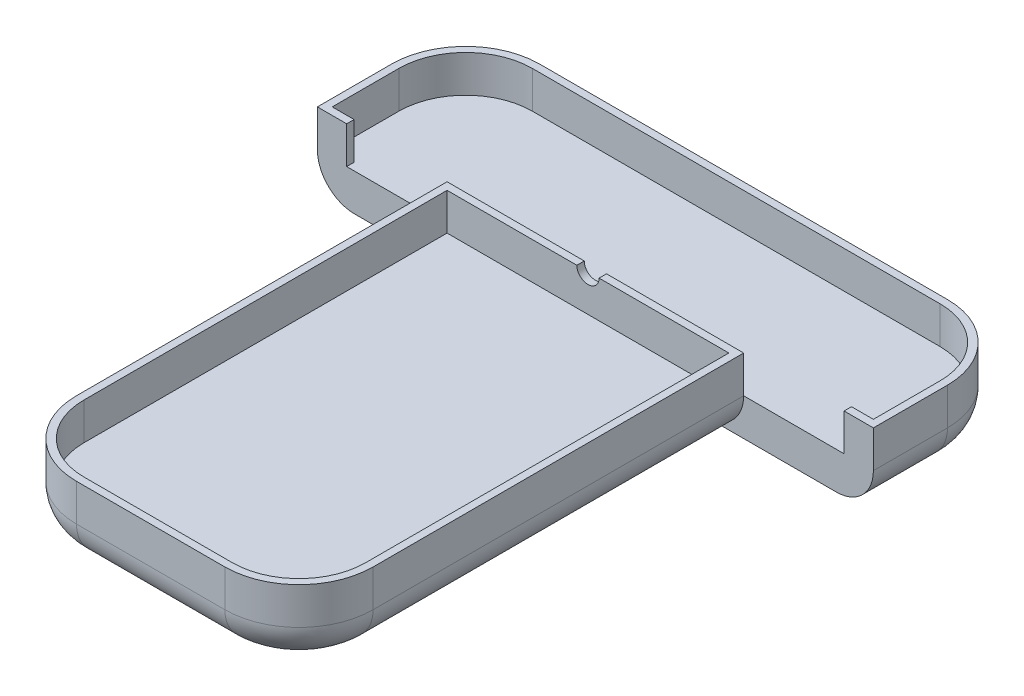
from build123d import *

# Parameters (mm, degrees)
BOSS_EXTRUDE1_DEPTH  = 25.4
FILLET1_R            = 12.7
FILLET3_R            = 25.4
FILLET4_R            = 25.4
FILLET5_R            = 25.4
SHELL1_T             = -2.54
EXTRUDE_THIN1_REACH  = 252.592
SKETCH2_W            = 2.54
SKETCH2_H            = 198.12
EXTRUDE_THIN4_REACH  = 252.592
SKETCH3_W            = 47.014483258
SKETCH3_H            = 2.54
SKETCH3_W_2          = 47.014483257
EXTRUDE_THIN5_REACH  = 252.592
SKETCH5_W            = 47.014483258
SKETCH5_H            = 2.54
SKETCH5_W_2          = 47.014483257
EXTRUDE_THIN10_START = 10.16
EXTRUDE_THIN10_DEPTH = 2.54
EXTRUDE_THIN11_START = 10.16
EXTRUDE_THIN11_DEPTH = 2.54
CUT_EXTRUDE2_REACH   = 214.64
SKETCH11_W           = 34.417
SKETCH11_H           = 12.7
CUT_EXTRUDE3_REACH   = 253.556
SKETCH12_W           = 2.54
SKETCH12_H           = 12.7
CUT_EXTRUDE4_REACH   = 253.556
SKETCH13_W           = 2.54
SKETCH13_H           = 12.7
SKETCH14_W           = 96.568966515
SKETCH14_H           = 2.54
EXTRUDE_THIN13_DEPTH = 12.7
CUT_EXTRUDE6_REACH   = 212.827


with BuildPart() as part:
    # Sketch1 → Boss-Extrude1 (new body)
    with BuildSketch(Plane(origin=(0, 0, 0), x_dir=(1, 0, 0), z_dir=(0, 1, 0))):
        Polygon((0, 0), (0, 152.4), (-44.45, 152.4), (-44.45, 203.2), (146.098966515, 203.2), (146.098966515, 152.4), (101.648966515, 152.4), (101.648966515, 0), align=None)
    extrude(amount=BOSS_EXTRUDE1_DEPTH)

    # Fillet1
    fillet1_edges = [part.edges().sort_by_distance(p)[0] for p in [
        (146.098966515, 0, -177.8),
        (101.648966515, 0, -76.2),
        (50.824483258, 0, 0),
        (0, 0, -76.2),
        (-44.45, 0, -177.8),
        (50.824483258, 0, -203.2),
    ]]
    fillet(fillet1_edges, radius=FILLET1_R)

    # Fillet3
    # the kernel refuses this fillet: 25.4 mm, written as the material it takes off along each edge
    with BuildSketch(Plane(origin=(76.248966515, 0, -25.4), x_dir=(1, 0, 0), z_dir=(0, 0, -1))) as fillet3_piece_1:
        with BuildLine():
            CenterArc((12.7, -12.7), 12.7, 0, 90)
            Line((25.4, -12.7), (25.4, 0))
            Line((25.4, 0), (12.7, 0))
        make_face()
    revolve(axis=Axis((76.248966515, 0, -25.4), (0, -1, 0)), revolution_arc=90, mode=Mode.SUBTRACT)
    with BuildSketch(Plane(origin=(101.648966515, 0, 0), x_dir=(0, 0, -1), z_dir=(0, 1, 0))) as fillet3_piece_2:
        with BuildLine():
            CenterArc((FILLET3_R, FILLET3_R), FILLET3_R, 180, 90)
            Line((0, FILLET3_R), (0, 0))
            Line((0, 0), (FILLET3_R, 0))
        make_face()
    extrude(amount=88.9, mode=Mode.SUBTRACT)

    # Fillet4
    # the kernel refuses this fillet: 25.4 mm, written as the material it takes off along each edge
    with BuildSketch(Plane(origin=(25.4, 0, -25.4), x_dir=(0, 0, 1), z_dir=(1, 0, 0))) as fillet4_piece_1:
        with BuildLine():
            CenterArc((12.7, -12.7), 12.7, 0, 90)
            Line((25.4, -12.7), (25.4, 0))
            Line((25.4, 0), (12.7, 0))
        make_face()
    revolve(axis=Axis((25.4, 0, -25.4), (0, -1, 0)), revolution_arc=90, mode=Mode.SUBTRACT)
    with BuildSketch(Plane(origin=(0, 0, 0), x_dir=(0, 0, -1), z_dir=(0, 1, 0))) as fillet4_piece_2:
        with BuildLine():
            CenterArc((FILLET4_R, -FILLET4_R), FILLET4_R, 90, 90)
            Line((0, -FILLET4_R), (0, 0))
            Line((0, 0), (FILLET4_R, 0))
        make_face()
    extrude(amount=88.9, mode=Mode.SUBTRACT)

    # Fillet5
    # the kernel refuses this fillet: 25.4 mm, written as the material it takes off along each edge
    with BuildSketch(Plane(origin=(120.698966515, 0, -177.8), x_dir=(0, 0, -1), z_dir=(-1, 0, 0))) as fillet5_piece_1:
        with BuildLine():
            CenterArc((12.7, -12.7), 12.7, 0, 90)
            Line((25.4, -12.7), (25.4, 0))
            Line((25.4, 0), (12.7, 0))
        make_face()
    revolve(axis=Axis((120.698966515, 0, -177.8), (0, -1, 0)), revolution_arc=90, mode=Mode.SUBTRACT)
    with BuildSketch(Plane(origin=(-19.05, 0, -177.8), x_dir=(-1, 0, 0), z_dir=(0, 0, 1))) as fillet5_piece_2:
        with BuildLine():
            CenterArc((12.7, -12.7), 12.7, 0, 90)
            Line((25.4, -12.7), (25.4, 0))
            Line((25.4, 0), (12.7, 0))
        make_face()
    revolve(axis=Axis((-19.05, 0, -177.8), (0, -1, 0)), revolution_arc=90, mode=Mode.SUBTRACT)
    with BuildSketch(Plane(origin=(-44.45, 0, -203.2), x_dir=(0, 0, 1), z_dir=(0, 1, 0))) as fillet5_piece_3:
        with BuildLine():
            CenterArc((FILLET5_R, FILLET5_R), FILLET5_R, 180, 90)
            Line((0, FILLET5_R), (0, 0))
            Line((0, 0), (FILLET5_R, 0))
        make_face()
    extrude(amount=88.9, mode=Mode.SUBTRACT)
    with BuildSketch(Plane(origin=(146.098966515, 0, -203.2), x_dir=(0, 0, 1), z_dir=(0, 1, 0))) as fillet5_piece_4:
        with BuildLine():
            CenterArc((FILLET5_R, -FILLET5_R), FILLET5_R, 90, 90)
            Line((0, -FILLET5_R), (0, 0))
            Line((0, 0), (FILLET5_R, 0))
        make_face()
    extrude(amount=88.9, mode=Mode.SUBTRACT)

    # Shell1
    shell1_openings = [part.faces().sort_by_distance(p)[0] for p in [
        (50.824483258, 25.4, -115.579080846),
    ]]
    offset(amount=SHELL1_T, openings=shell1_openings, kind=Kind.INTERSECTION)

    # Sketch2 → Extrude-Thin1 (add, up to next)
    with BuildSketch(Plane(origin=(0, 12.7, 0), x_dir=(1, 0, 0), z_dir=(0, 1, 0)), mode=Mode.PRIVATE) as extrude_thin1_sk1:
        with Locations((50.824483258, 101.6)):
            Rectangle(SKETCH2_W, SKETCH2_H)
    extrude_thin1_tool1 = extrude(extrude_thin1_sk1.sketch, amount=-EXTRUDE_THIN1_REACH, mode=Mode.PRIVATE) - part.part
    add(extrude_thin1_tool1.solids().sort_by_distance((50.824483, 12.7, -101.6))[0])

    # Sketch3 → Extrude-Thin4 (add, up to next)
    with BuildSketch(Plane(origin=(0, 12.7, 0), x_dir=(1, 0, 0), z_dir=(0, 1, 0)), mode=Mode.PRIVATE) as extrude_thin4_sk1:
        with Locations((26.047241629, 66.04)):
            Rectangle(SKETCH3_W, SKETCH3_H)
    extrude_thin4_tool1 = extrude(extrude_thin4_sk1.sketch, amount=-EXTRUDE_THIN4_REACH, mode=Mode.PRIVATE) - part.part
    # Sketch3 → Extrude-Thin4 (add, up to next)
    with BuildSketch(Plane(origin=(0, 12.7, 0), x_dir=(1, 0, 0), z_dir=(0, 1, 0)), mode=Mode.PRIVATE) as extrude_thin4_sk2:
        with Locations((75.601724887, 66.04)):
            Rectangle(SKETCH3_W_2, SKETCH3_H)
    extrude_thin4_tool2 = extrude(extrude_thin4_sk2.sketch, amount=-EXTRUDE_THIN4_REACH, mode=Mode.PRIVATE) - part.part
    add(extrude_thin4_tool1.solids().sort_by_distance((26.047242, 12.7, -66.04))[0])
    add(extrude_thin4_tool2.solids().sort_by_distance((75.601725, 12.7, -66.04))[0])

    # Sketch5 → Extrude-Thin5 (add, up to next)
    with BuildSketch(Plane(origin=(0, 12.7, 0), x_dir=(1, 0, 0), z_dir=(0, 1, 0)), mode=Mode.PRIVATE) as extrude_thin5_sk1:
        with Locations((26.047241629, 143.51)):
            Rectangle(SKETCH5_W, SKETCH5_H)
    extrude_thin5_tool1 = extrude(extrude_thin5_sk1.sketch, amount=-EXTRUDE_THIN5_REACH, mode=Mode.PRIVATE) - part.part
    # Sketch5 → Extrude-Thin5 (add, up to next)
    with BuildSketch(Plane(origin=(0, 12.7, 0), x_dir=(1, 0, 0), z_dir=(0, 1, 0)), mode=Mode.PRIVATE) as extrude_thin5_sk2:
        with Locations((75.601724887, 143.51)):
            Rectangle(SKETCH5_W_2, SKETCH5_H)
    extrude_thin5_tool2 = extrude(extrude_thin5_sk2.sketch, amount=-EXTRUDE_THIN5_REACH, mode=Mode.PRIVATE) - part.part
    add(extrude_thin5_tool1.solids().sort_by_distance((26.047242, 12.7, -143.51))[0])
    add(extrude_thin5_tool2.solids().sort_by_distance((75.601725, 12.7, -143.51))[0])

    # Extrude-Thin10: read off the stored shape, not the designer's step
    # Extrude-Thin10 outline → Extrude-Thin10 (add)
    with BuildSketch(Plane(origin=(0, 0, 0), x_dir=(1, 0, 0), z_dir=(0, 1, 0)).offset(EXTRUDE_THIN10_START)):
        with BuildLine():
            ThreePointArc((2.54, 25.4), (9.235538982, 9.235538982), (25.4, 2.54))
            Line((25.4, 2.54), (52.094483258, 2.54))
            Line((52.094483258, 2.54), (52.094483258, 64.77))
            Line((52.094483258, 64.77), (99.108966515, 64.77))
            Line((99.108966515, 64.77), (99.108966515, 67.31))
            Line((99.108966515, 67.31), (52.094483258, 67.31))
            Line((52.094483258, 67.31), (52.094483258, 142.24))
            Line((52.094483258, 142.24), (99.108966515, 142.24))
            Line((99.108966515, 142.24), (99.108966515, 144.78))
            Line((99.108966515, 144.78), (52.094483258, 144.78))
            Line((52.094483258, 144.78), (52.094483258, 200.66))
            Line((52.094483258, 200.66), (-19.05, 200.66))
            ThreePointArc((-19.05, 200.66), (-35.214461018, 193.964461018), (-41.91, 177.8))
            Line((-41.91, 177.8), (-41.91, 154.94))
            Line((-41.91, 154.94), (2.54, 154.94))
            Line((2.54, 154.94), (2.54, 25.4))
        make_face()
    extrude(amount=EXTRUDE_THIN10_DEPTH)

    # Extrude-Thin11: read off the stored shape, not the designer's step
    # Extrude-Thin11 outline → Extrude-Thin11 (add)
    with BuildSketch(Plane(origin=(0, 0, 0), x_dir=(1, 0, 0), z_dir=(0, 1, 0)).offset(EXTRUDE_THIN11_START)):
        with BuildLine():
            ThreePointArc((2.54, 25.4), (9.235538982, 9.235538982), (25.4, 2.54))
            Line((25.4, 2.54), (76.248966515, 2.54))
            ThreePointArc((76.248966515, 2.54), (92.413427533, 9.235538982), (99.108966515, 25.4))
            Line((99.108966515, 25.4), (99.108966515, 154.94))
            Line((99.108966515, 154.94), (143.558966515, 154.94))
            Line((143.558966515, 154.94), (143.558966515, 177.8))
            ThreePointArc((143.558966515, 177.8), (136.863427533, 193.964461018), (120.698966515, 200.66))
            Line((120.698966515, 200.66), (-19.05, 200.66))
            ThreePointArc((-19.05, 200.66), (-35.214461018, 193.964461018), (-41.91, 177.8))
            Line((-41.91, 177.8), (-41.91, 154.94))
            Line((-41.91, 154.94), (2.54, 154.94))
            Line((2.54, 154.94), (2.54, 25.4))
        make_face()
    extrude(amount=EXTRUDE_THIN11_DEPTH)

    # Sketch11 → Cut-Extrude2 (cut, up to next)
    with BuildSketch(Plane.XY.offset(-152.4), mode=Mode.PRIVATE) as cut_extrude2_sk1:
        with Locations((-17.2085, 19.05)):
            Rectangle(SKETCH11_W, SKETCH11_H)
    cut_extrude2_tool1 = extrude(cut_extrude2_sk1.sketch, amount=-CUT_EXTRUDE2_REACH, mode=Mode.PRIVATE) & part.part
    # Sketch11 → Cut-Extrude2 (cut, up to next)
    with BuildSketch(Plane.XY.offset(-152.4), mode=Mode.PRIVATE) as cut_extrude2_sk2:
        with Locations((118.857466515, 19.05)):
            Rectangle(SKETCH11_W, SKETCH11_H)
    cut_extrude2_tool2 = extrude(cut_extrude2_sk2.sketch, amount=-CUT_EXTRUDE2_REACH, mode=Mode.PRIVATE) & part.part
    add(cut_extrude2_tool1.solids().sort_by_distance((-17.2085, 19.05, -152.4))[0], mode=Mode.SUBTRACT)
    add(cut_extrude2_tool2.solids().sort_by_distance((118.857467, 19.05, -152.4))[0], mode=Mode.SUBTRACT)

    # Sketch12 → Cut-Extrude3 (cut, up to next)
    with BuildSketch(Plane(origin=(101.648966515, 0, 0), x_dir=(0, 0, -1), z_dir=(1, 0, 0)), mode=Mode.PRIVATE) as cut_extrude3_sk1:
        with Locations((153.67, 19.05)):
            Rectangle(SKETCH12_W, SKETCH12_H)
    cut_extrude3_tool1 = extrude(cut_extrude3_sk1.sketch, amount=-CUT_EXTRUDE3_REACH, mode=Mode.PRIVATE) & part.part
    add(cut_extrude3_tool1.solids().sort_by_distance((101.648967, 19.05, -153.67))[0], mode=Mode.SUBTRACT)

    # Sketch13 → Cut-Extrude4 (cut, up to next)
    with BuildSketch(Plane.ZY, mode=Mode.PRIVATE) as cut_extrude4_sk1:
        with Locations((-153.67, 19.05)):
            Rectangle(SKETCH13_W, SKETCH13_H)
    cut_extrude4_tool1 = extrude(cut_extrude4_sk1.sketch, amount=-CUT_EXTRUDE4_REACH, mode=Mode.PRIVATE) & part.part
    add(cut_extrude4_tool1.solids().sort_by_distance((0, 19.05, -153.67))[0], mode=Mode.SUBTRACT)

    # Sketch14 → Extrude-Thin13 (add)
    with BuildSketch(Plane(origin=(0, 12.7, 0), x_dir=(1, 0, 0), z_dir=(0, 1, 0))):
        with Locations((50.824483258, 151.13)):
            Rectangle(SKETCH14_W, SKETCH14_H)
    extrude(amount=EXTRUDE_THIN13_DEPTH)

    # Sketch16 → Cut-Extrude6 (cut, up to next)
    with BuildSketch(Plane.XY.offset(-149.86), mode=Mode.PRIVATE) as cut_extrude6_sk1:
        with BuildLine():
            Line((47.014483258, 25.4), (54.634483258, 25.4))
            ThreePointArc((54.634483258, 25.4), (50.824483258, 21.59), (47.014483258, 25.4))
        make_face()
    cut_extrude6_tool1 = extrude(cut_extrude6_sk1.sketch, amount=-CUT_EXTRUDE6_REACH, mode=Mode.PRIVATE) & part.part
    add(cut_extrude6_tool1.solids().sort_by_distance((50.824483, 23.782986, -149.86))[0], mode=Mode.SUBTRACT)


solid = part.part
